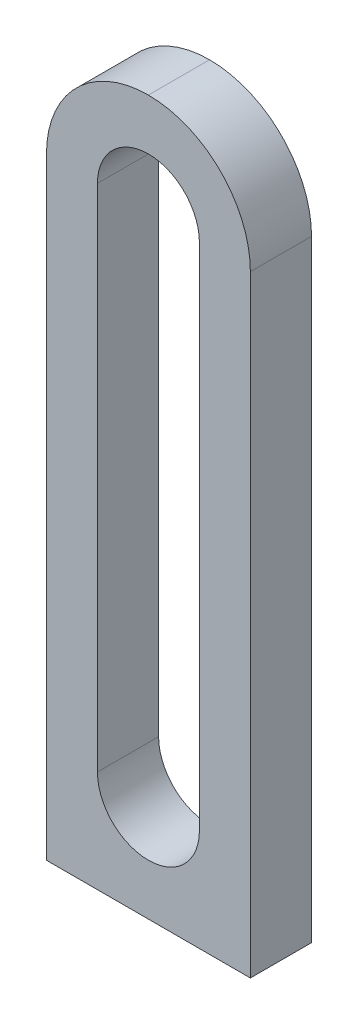
from build123d import *

# Parameters (mm, degrees)
SKETCH1_W          = 10
SKETCH1_H          = 35
BASE_FLANGE1_DEPTH = 3
FILLET1_R          = 5


# Sheet-metal steps are written as plain solids
with BuildPart() as part:
    # Sketch1 → Base-Flange1 (new body)
    with BuildSketch(Plane.XY):
        Rectangle(SKETCH1_W, SKETCH1_H)
        with BuildLine():
            Line((-2.5, -12.5), (-2.5, 12.5))
            ThreePointArc((-2.5, 12.5), (0, 15), (2.5, 12.5))
            Line((2.5, 12.5), (2.5, -12.5))
            ThreePointArc((2.5, -12.5), (0, -15), (-2.5, -12.5))
        make_face(mode=Mode.SUBTRACT)
    extrude(amount=-BASE_FLANGE1_DEPTH)

    # Fillet1
    fillet1_edges = [part.edges().sort_by_distance(p)[0] for p in [
        (-5, 17.5, -1.5),
        (5, 17.5, -1.5),
    ]]
    fillet(fillet1_edges, radius=FILLET1_R - 0.0001)  # a hair under: the kernel refuses the full size


solid = part.part
